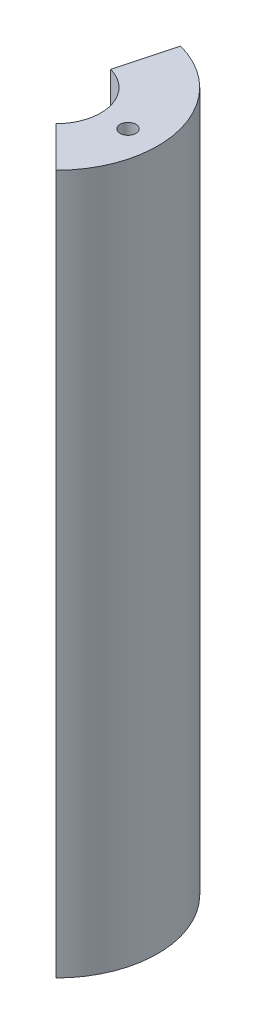
from build123d import *

# Parameters (mm, degrees)
SKETCH1_R           = 1.25
BOSS_EXTRUDE1_DEPTH = 110.3


with BuildPart() as part:
    # Sketch1 → Boss-Extrude1 (new body)
    with BuildSketch(Plane(origin=(0, 0, 0), x_dir=(1, 0, 0), z_dir=(0, 1, 0))):
        with BuildLine():
            Line((4.949747468, -4.949747468), (11.313708499, -11.313708499))
            ThreePointArc((11.313708499, -11.313708499), (15.454813221, 4.141104722), (4.141104722, 15.454813221))
            Line((4.141104722, 15.454813221), (1.811733316, 6.761480784))
            ThreePointArc((1.811733316, 6.761480784), (6.761480784, 1.811733316), (4.949747468, -4.949747468))
        make_face()
        with Locations((11.313708499, 0)):
            Circle(SKETCH1_R, mode=Mode.SUBTRACT)
    extrude(amount=BOSS_EXTRUDE1_DEPTH)


solid = part.part
